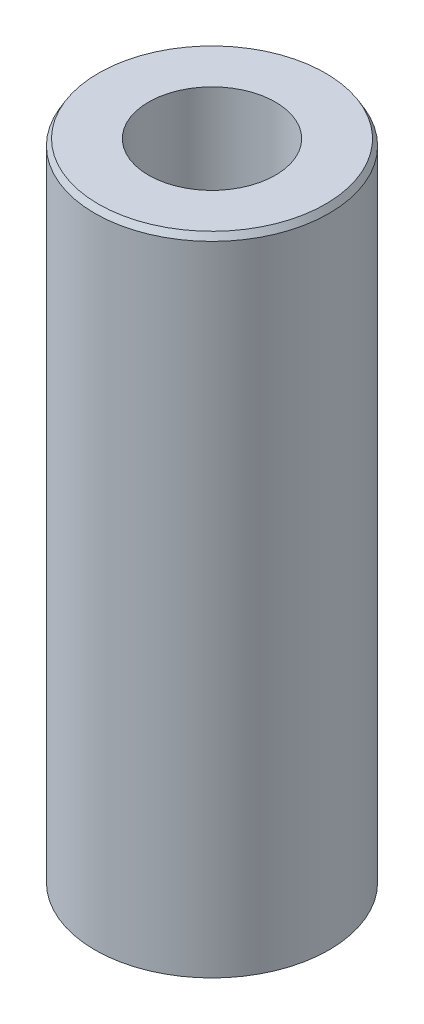
from build123d import *
from OCP.BRepFilletAPI import BRepFilletAPI_MakeChamfer

# Parameters (mm, degrees)
SKETCH1_R           = 52.5
BOSS_EXTRUDE1_DEPTH = 290.363429526
SKETCH2_R           = 28.437443311
CUT_EXTRUDE1_DEPTH  = 300.705557516
CHAMFER1_SIZE       = 2.789445907
CHAMFER1_SIZE2      = 1.610487345


with BuildPart() as part:
    # Sketch1 → Boss-Extrude1 (new body)
    with BuildSketch(Plane(origin=(0, 0, 0), x_dir=(1, 0, 0), z_dir=(0, 1, 0))):
        Circle(SKETCH1_R)
    extrude(amount=BOSS_EXTRUDE1_DEPTH)

    # Sketch2 → Cut-Extrude1 (cut, through all)
    with BuildSketch(Plane(origin=(0, 0, 0), x_dir=(1, 0, 0), z_dir=(0, 1, 0))):
        Circle(SKETCH2_R)
    extrude(amount=CUT_EXTRUDE1_DEPTH, mode=Mode.SUBTRACT)

    # Chamfer1: one chamfer whose edges measure the first distance from different faces: ONE call of the kernel's chamfer builder (chamfer() names one face for all edges)
    chamfer1_edges_1 = [part.edges().sort_by_distance(p)[0] for p in [
        (-52.5, 290.363429526, 0),
    ]]
    chamfer1_side_1 = [part.faces().sort_by_distance(p)[0] for p in [
        (-52.5, 145.181714763, 0),
    ]]
    chamfer1_edges_2 = [part.edges().sort_by_distance(p)[0] for p in [
        (-52.5, 0, 0),
    ]]
    chamfer1_side_2 = [part.faces().sort_by_distance(p)[0] for p in [
        (-51.01507576, 0, 0),
    ]]
    chamfer1 = BRepFilletAPI_MakeChamfer(part.part.solid().wrapped)
    for e in chamfer1_edges_1:
        chamfer1.Add(CHAMFER1_SIZE, CHAMFER1_SIZE2, e.wrapped, chamfer1_side_1[0].wrapped)  # the first distance lies on this face
    for e in chamfer1_edges_2:
        chamfer1.Add(CHAMFER1_SIZE, CHAMFER1_SIZE2, e.wrapped, chamfer1_side_2[0].wrapped)  # the first distance lies on this face
    add(Compound.cast(chamfer1.Shape()), mode=Mode.REPLACE)


solid = part.part
